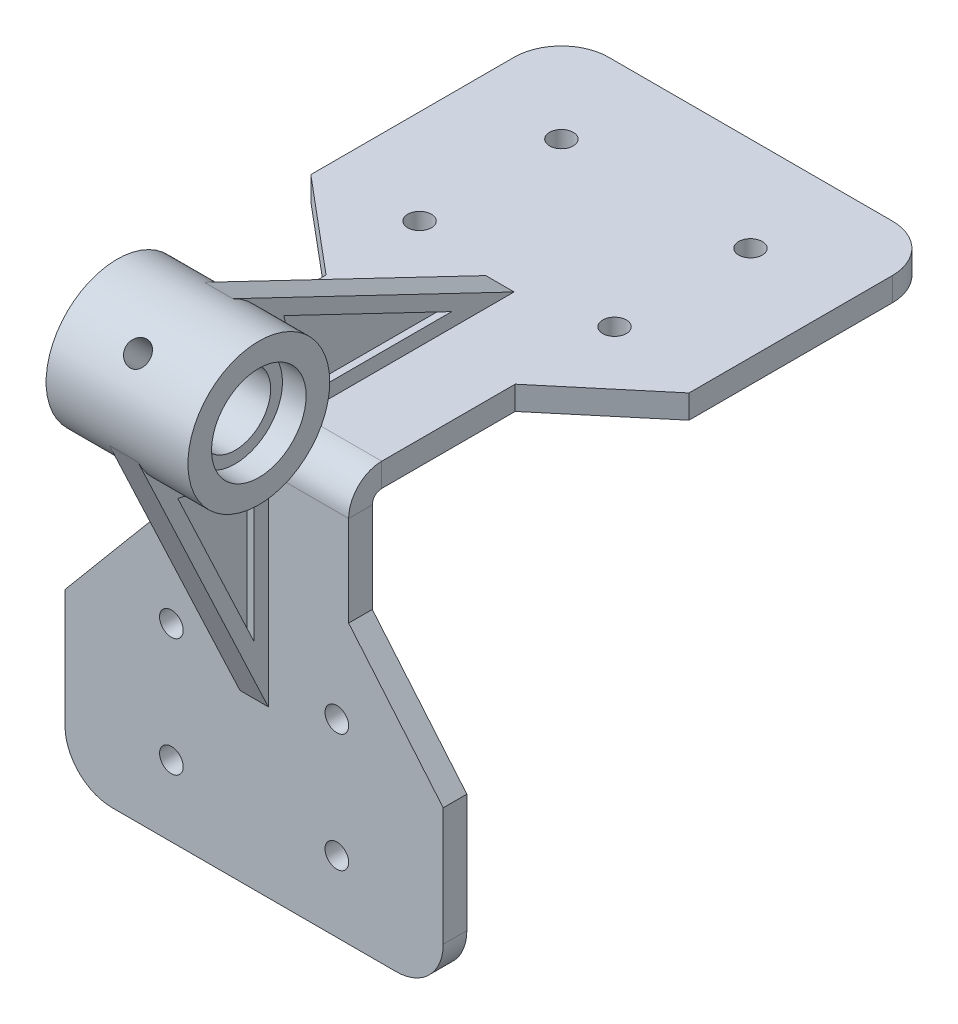
from build123d import *

# Parameters (mm, degrees)
SKETCH1_R                    = 2.5
BASE_FLANGE1_DEPTH           = 5
SKETCH6_R                    = 2.5
BASE_FLANGE2_DEPTH           = 5
EDGE_FLANGE1_STRIP_W         = 24
EDGE_FLANGE1_STRIP_H         = 5
EDGE_FLANGE1_STRIP_CUT_DEPTH = 40
EDGE_FLANGE1_DEPTH           = 40
SKETCH19_R                   = 15
SKETCH19_R_2                 = 7.5
BOSS_EXTRUDE1_DEPTH          = 15
SKETCH20_R                   = 10
CUT_EXTRUDE1_DEPTH           = 5
BOSS_EXTRUDE2_DEPTH          = 3
CUT_EXTRUDE3_START           = 1.5
CUT_EXTRUDE3_DEPTH           = 1.5
CUT_EXTRUDE4_START           = 20
SKETCH23_R                   = 2.5
CUT_EXTRUDE4_DEPTH           = 126.187158898


# Sheet-metal steps are written as plain solids
with BuildPart() as part:
    # Sketch1 → Base-Flange1 (new body)
    with BuildSketch(Plane.XY):
        with BuildLine():
            Line((-30, 0), (30, 0))
            ThreePointArc((30, 0), (37.071067812, 2.928932188), (40, 10))
            Line((40, 10), (40, 35))
            Line((40, 35), (20, 58.835071852))
            Line((20, 58.835071852), (20, 85))
            Line((20, 85), (-20, 85))
            Line((-20, 85), (-20, 58.835071852))
            Line((-20, 58.835071852), (-40, 35))
            Line((-40, 35), (-40, 10))
            ThreePointArc((-40, 10), (-37.071067812, 2.928932188), (-30, 0))
        make_face()
        with Locations((17.5, 15)):
            Circle(SKETCH1_R, mode=Mode.SUBTRACT)
        with Locations((-17.5, 15)):
            Circle(SKETCH1_R, mode=Mode.SUBTRACT)
        with Locations((-17.5, 40)):
            Circle(SKETCH1_R, mode=Mode.SUBTRACT)
        with Locations((17.5, 40)):
            Circle(SKETCH1_R, mode=Mode.SUBTRACT)
    extrude(amount=BASE_FLANGE1_DEPTH)

    # Edge-Flange1 strip (across the edge) → Edge-Flange1 strip cut (cut)
    with BuildSketch(Plane(origin=(-20, 85, 0), x_dir=(0, -1, 0), z_dir=(1, 0, 0))):
        with Locations((-5, -2.5)):
            Rectangle(EDGE_FLANGE1_STRIP_W, EDGE_FLANGE1_STRIP_H)
    extrude(amount=EDGE_FLANGE1_STRIP_CUT_DEPTH, mode=Mode.SUBTRACT)

    # Edge-Flange1 section (across the edge) → Edge-Flange1 (add)
    with BuildSketch(Plane(origin=(-20, 85, 0), x_dir=(0, -1, 0), z_dir=(1, 0, 0))):
        with BuildLine():
            Line((0, 2), (0, 30.218007376))
            Line((0, 30.218007376), (5, 30.218007376))
            Line((5, 30.218007376), (5, 2))
            ThreePointArc((5, 2), (5.585786438, 0.585786438), (7, 0))
            Line((7, 0), (7, -5))
            ThreePointArc((7, -5), (2.050252532, -2.949747468), (0, 2))
        make_face()
    extrude(amount=EDGE_FLANGE1_DEPTH)


with BuildPart() as body_2:
    # Sketch6 → Base-Flange2 (new body)
    with BuildSketch(Plane(origin=(0, 85, 0), x_dir=(1, 0, 0), z_dir=(0, 1, 0))):
        with BuildLine():
            Line((-30, 100), (30, 100))
            ThreePointArc((30, 100), (37.071067812, 97.071067812), (40, 90))
            Line((40, 90), (40, 47))
            Line((40, 47), (20, 30.218007376))
            Line((20, 30.218007376), (-20, 30.218007376))
            Line((-20, 30.218007376), (-40, 47))
            Line((-40, 47), (-40, 90))
            ThreePointArc((-40, 90), (-37.071067812, 97.071067812), (-30, 100))
        make_face()
        with Locations(Location((-20, 80, 0), (0, 0, 270))):
            Circle(SKETCH6_R, mode=Mode.SUBTRACT)
        with Locations(Location((20, 80, 0), (0, 0, 90))):
            Circle(SKETCH6_R, mode=Mode.SUBTRACT)
        with Locations(Location((20, 51.246765298, 0), (0, 0, 270))):
            Circle(SKETCH6_R, mode=Mode.SUBTRACT)
        with Locations(Location((-20, 50, 0), (0, 0, 90))):
            Circle(SKETCH6_R, mode=Mode.SUBTRACT)
    extrude(amount=-BASE_FLANGE2_DEPTH)

    # Combine2: union part
    add(part.part)



with BuildPart() as body_2_2:
    # Sketch19 → Boss-Extrude1 (new, symmetric)
    with BuildSketch(Plane(origin=(0, 0, 0), x_dir=(0, 0, -1), z_dir=(1, 0, 0))):
        with Locations((-19, 100)):
            Circle(SKETCH19_R)
        with Locations((-19, 100)):
            Circle(SKETCH19_R_2, mode=Mode.SUBTRACT)
    extrude(amount=BOSS_EXTRUDE1_DEPTH, both=True)

    # Sketch20 → Cut-Extrude1 (cut)
    with BuildSketch(Plane(origin=(15, 0, 0), x_dir=(0, 0, -1), z_dir=(1, 0, 0))):
        with Locations((-19, 100)):
            Circle(SKETCH20_R)
    cut_extrude1 = extrude(amount=-CUT_EXTRUDE1_DEPTH, mode=Mode.SUBTRACT)

    # Mirror1: Cut-Extrude1 across plane
    add(cut_extrude1.mirror(Plane(origin=(0, 0, 0), x_dir=(0, 0, 1), z_dir=(1, 0, 0))), mode=Mode.SUBTRACT)


with BuildPart() as body_2_1:
    add(body_2.part)

    add(body_2_2.part)  # Boss-Extrude2 merges body 2 2
    # Sketch21 → Boss-Extrude2 (add, symmetric)
    with BuildSketch(Plane(origin=(0, 0, 0), x_dir=(0, 0, -1), z_dir=(1, 0, 0))):
        with BuildLine():
            Line((-32.573201875, 93.615002673), (-5, 35))
            Line((-5, 35), (-5, 78))
            ThreePointArc((-5, 78), (-2.949747468, 82.949747468), (2, 85))
            Line((2, 85), (47, 85))
            Line((47, 85), (-12.516699411, 113.526522593))
            ThreePointArc((-12.516699411, 113.526522593), (-8.431942873, 89.354993257), (-32.573201875, 93.615002673))
        make_face()
    extrude(amount=BOSS_EXTRUDE2_DEPTH, both=True)

    # Sketch22 → Cut-Extrude3 (cut)
    with BuildSketch(Plane(origin=(0, 0, 0), x_dir=(0, 0, -1), z_dir=(1, 0, 0)).offset(CUT_EXTRUDE3_START)):
        with BuildLine():
            Line((-24.147646276, 82.751761313), (-8, 48.425159203))
            Line((-8, 48.425159203), (-8, 85.752193151))
            ThreePointArc((-8, 85.752193151), (-15.711663212, 82.302914331), (-24.147646276, 82.751761313))
        make_face()
        with BuildLine():
            Line((33.8, 88), (-1.714869921, 105.02237774))
            ThreePointArc((-1.714869921, 105.02237774), (-1.447608596, 96.010820135), (-5.583592135, 88))
            Line((-5.583592135, 88), (33.8, 88))
        make_face()
    cut_extrude3 = extrude(amount=CUT_EXTRUDE3_DEPTH, mode=Mode.SUBTRACT)

    # Mirror4: Cut-Extrude3 across plane
    add(cut_extrude3.mirror(Plane(origin=(0, 0, 0), x_dir=(0, 0, 1), z_dir=(1, 0, 0))), mode=Mode.SUBTRACT)

    # Sketch23 → Cut-Extrude4 (cut, through all)
    with BuildSketch(Plane(origin=(20, 82.949747468, 2.949747468), x_dir=(1, 0, 0), z_dir=(0, 0.7071067811865468, 0.7071067811865483)).offset(CUT_EXTRUDE4_START)):
        with Locations(Location((-20, 0.707106781, 0), (0, 0, 90))):
            Circle(SKETCH23_R)
    extrude(amount=CUT_EXTRUDE4_DEPTH, mode=Mode.SUBTRACT)


solid = body_2_1.part
